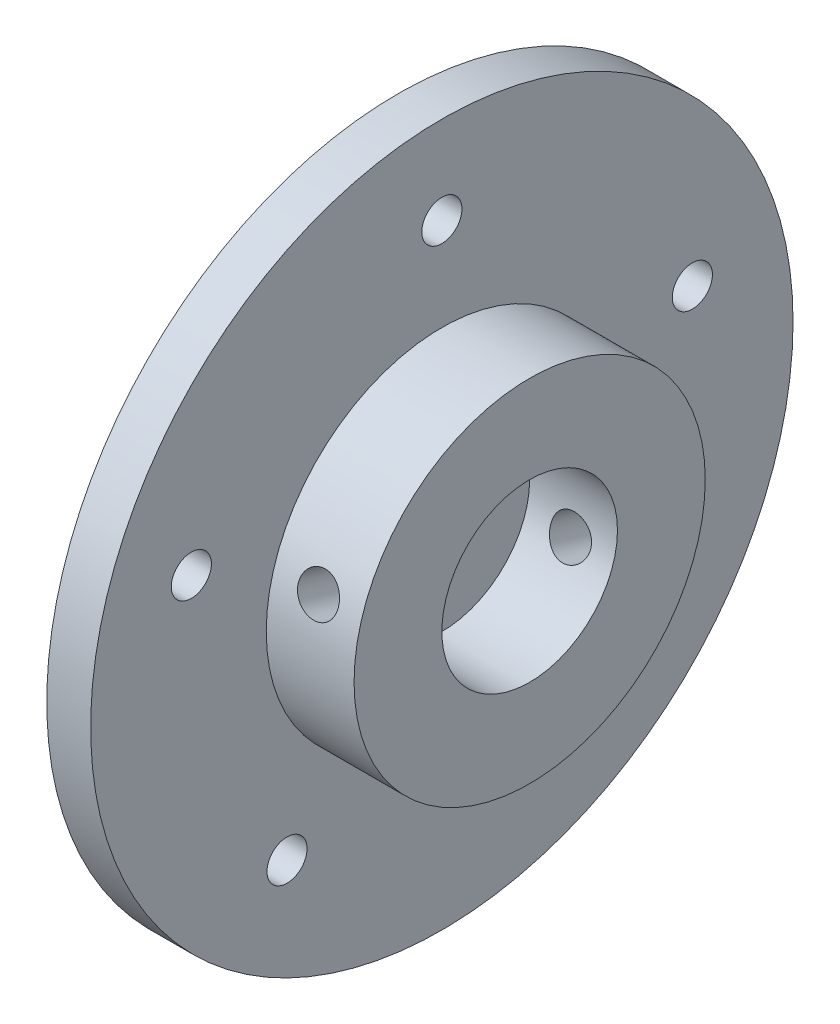
from build123d import *

# Parameters (mm, degrees)
SKETCH1_R           = 50.8
SKETCH1_R_2         = 2.9
BOSS_EXTRUDE1_DEPTH = 6.35
SKETCH2_R           = 25.4
BOSS_EXTRUDE2_DEPTH = 12.7
SKETCH3_R           = 12.7
CUT_EXTRUDE1_DEPTH  = 12.7
SKETCH6_R           = 2.921
CUT_EXTRUDE3_DEPTH  = 50.8


with BuildPart() as part:
    # Sketch1 → Boss-Extrude1 (new body)
    with BuildSketch(Plane(origin=(0, 0, 0), x_dir=(0, 0, -1), z_dir=(1, 0, 0))):
        with Locations((0, 0.711302035)):
            Circle(SKETCH1_R)
        with Locations((-36.235253271, 12.484849521)):
            Circle(SKETCH1_R_2, mode=Mode.SUBTRACT)
        with Locations((-22.394618112, -30.112245451)):
            Circle(SKETCH1_R_2, mode=Mode.SUBTRACT)
        with Locations((22.394618112, -30.112245451)):
            Circle(SKETCH1_R_2, mode=Mode.SUBTRACT)
        with Locations((36.235253271, 12.484849521)):
            Circle(SKETCH1_R_2, mode=Mode.SUBTRACT)
        with Locations((0, 38.811302035)):
            Circle(SKETCH1_R_2, mode=Mode.SUBTRACT)
    extrude(amount=BOSS_EXTRUDE1_DEPTH)

    # Sketch2 → Boss-Extrude2 (add)
    with BuildSketch(Plane(origin=(6.35, 0, 0), x_dir=(0, 0, -1), z_dir=(1, 0, 0))):
        Circle(SKETCH2_R)
    extrude(amount=BOSS_EXTRUDE2_DEPTH)

    # Sketch3 → Cut-Extrude1 (cut)
    with BuildSketch(Plane(origin=(19.05, 0, 0), x_dir=(0, 0, -1), z_dir=(1, 0, 0))):
        Circle(SKETCH3_R)
    extrude(amount=-CUT_EXTRUDE1_DEPTH, mode=Mode.SUBTRACT)

    # Sketch6 → Cut-Extrude3 (cut)
    with BuildSketch(Plane(origin=(0, -7.313264087, -24.324394512), x_dir=(-1, 0, 0), z_dir=(0, -0.2879237829614873, -0.9576533272563441))):
        with Locations((-12.821101653, 0)):
            Circle(SKETCH6_R)
    extrude(amount=-CUT_EXTRUDE3_DEPTH, mode=Mode.SUBTRACT)


solid = part.part
